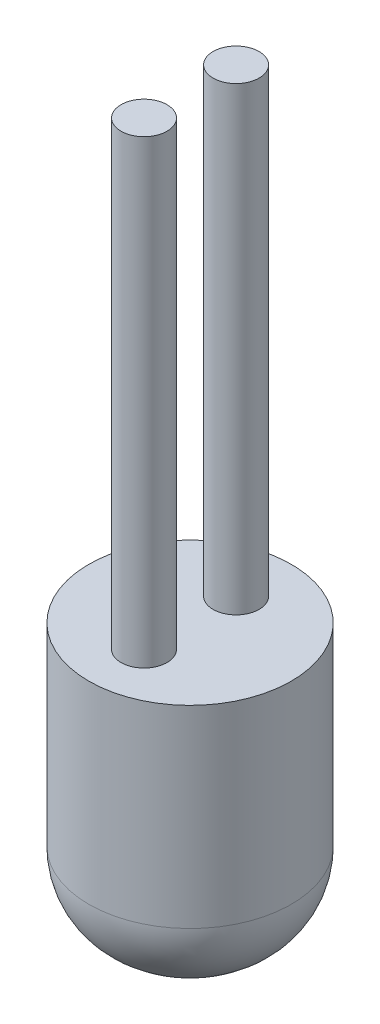
from build123d import *

# Parameters (mm, degrees)
SKETCH_1_R      = 1.1
EXTRUDE_1_DEPTH = 3
FILLET_1_R      = 0.9
SKETCH_2_R      = 0.25
EXTRUDE_2_DEPTH = 5


with BuildPart() as part:
    # 草图1 → 拉伸1 (new body)
    with BuildSketch(Plane(origin=(0, 0, 0), x_dir=(1, 0, 0), z_dir=(0, 1, 0))):
        Circle(SKETCH_1_R)
    extrude(amount=EXTRUDE_1_DEPTH)

    # 圆角1
    fillet_1_edges = [part.edges().sort_by_distance(p)[0] for p in [
        (-1.1, 0, 0),
    ]]
    fillet(fillet_1_edges, radius=FILLET_1_R)

    # 草图2 → 拉伸2 (add)
    with BuildSketch(Plane(origin=(0, 3, 0), x_dir=(-1, 0, 0), z_dir=(0, 1, 0))):
        with Locations((0, -0.5)):
            Circle(SKETCH_2_R)
        with Locations((0, 0.5)):
            Circle(SKETCH_2_R)
    extrude(amount=EXTRUDE_2_DEPTH)


solid = part.part
